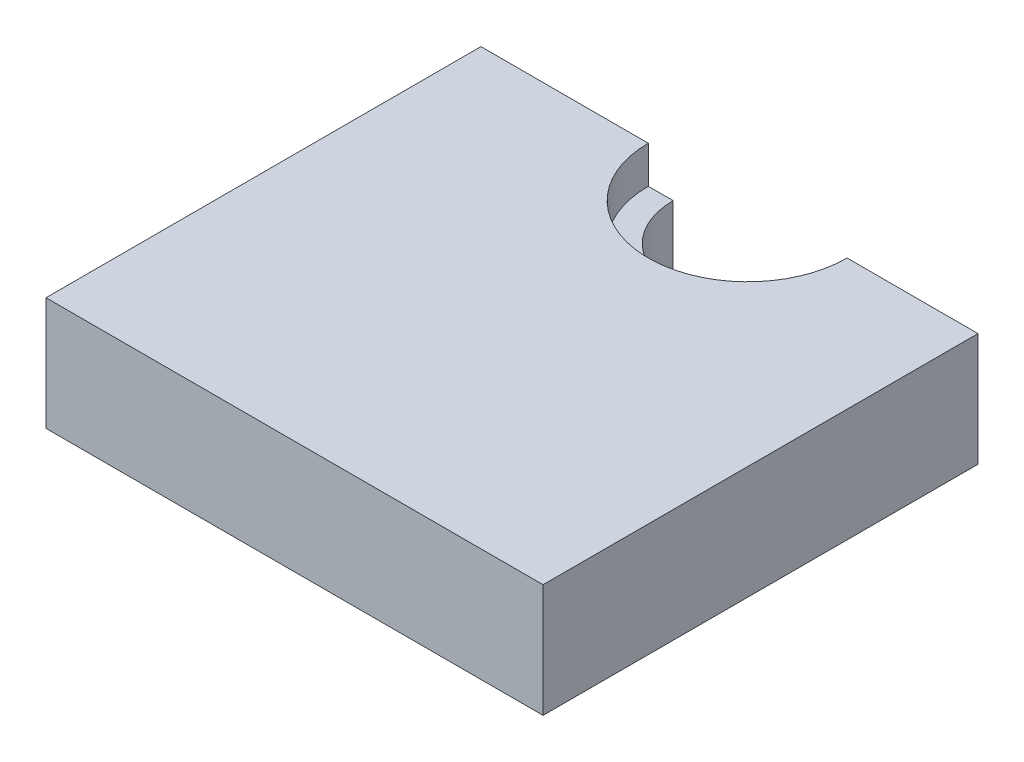
from build123d import *

# Parameters (mm, degrees)
SKETCH1_W           = 40
SKETCH1_H           = 9.108063915
BOSS_EXTRUDE1_DEPTH = 35
CAVITY1_START       = -4.108063915
CAVITY1_DEPTH       = 9.108063915
CAVITY1_START_2     = 2
CAVITY1_2_DEPTH     = 3
CAVITY1_3_DEPTH     = 0.108063915


# Read off the part's stored shape, not the designer's step: Cavity1
with BuildPart() as part:
    # Sketch1 → Boss-Extrude1 (new body)
    with BuildSketch(Plane.XY):
        with Locations((0, 0.445968042)):
            Rectangle(SKETCH1_W, SKETCH1_H)
    extrude(amount=BOSS_EXTRUDE1_DEPTH)

    # Cavity1 outline → Cavity1 (cut)
    with BuildSketch(Plane(origin=(0, 0, 0), x_dir=(1, 0, 0), z_dir=(0, 1, 0)).offset(CAVITY1_START)):
        with BuildLine():
            ThreePointArc((-4.532210811, 0), (1.467789189, -6), (7.467789189, 0))
            Line((7.467789189, 0), (-4.532210811, 0))
        make_face()
    extrude(amount=CAVITY1_DEPTH, mode=Mode.SUBTRACT)

    # Cavity1 2 outline → Cavity1 2 (cut)
    with BuildSketch(Plane(origin=(0, 0, 0), x_dir=(1, 0, 0), z_dir=(0, 1, 0)).offset(CAVITY1_START_2)):
        with BuildLine():
            ThreePointArc((-6.532210811, 0), (1.467789189, -8), (9.467789189, 0))
            Line((9.467789189, 0), (7.467789189, 0))
            ThreePointArc((7.467789189, 0), (1.467789189, -6), (-4.532210811, 0))
            Line((-4.532210811, 0), (-6.532210811, 0))
        make_face()
    extrude(amount=CAVITY1_2_DEPTH, mode=Mode.SUBTRACT)

    # Cavity1 3 outline → Cavity1 3 (cut)
    with BuildSketch(Plane(origin=(0, 0, 0), x_dir=(1, 0, 0), z_dir=(0, 1, 0)).offset(CAVITY1_START)):
        with BuildLine():
            ThreePointArc((-6.532210811, 0), (1.467789189, -8), (9.467789189, 0))
            Line((9.467789189, 0), (7.467789189, 0))
            ThreePointArc((7.467789189, 0), (1.467789189, -6), (-4.532210811, 0))
            Line((-4.532210811, 0), (-6.532210811, 0))
        make_face()
    extrude(amount=CAVITY1_3_DEPTH, mode=Mode.SUBTRACT)


solid = part.part
